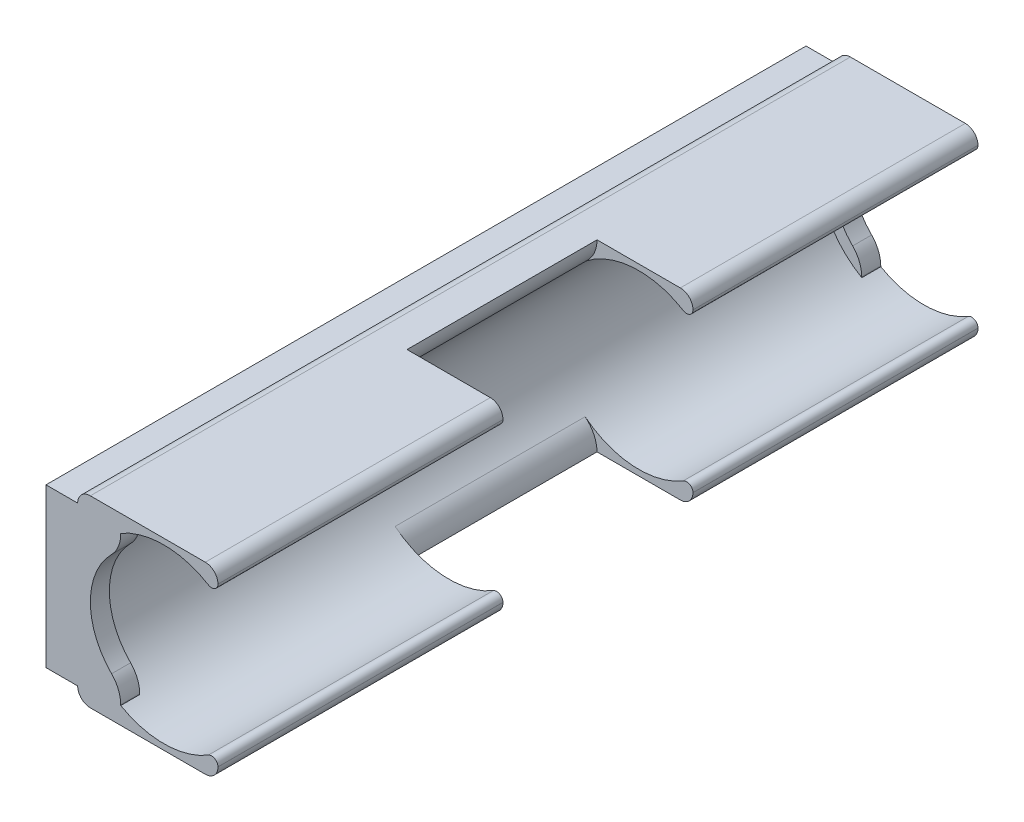
from build123d import *
from build123d.topology import SkipClean

# Parameters (mm, degrees)
SKETCH1_W          = 120
SKETCH1_H          = 25
BASE_DEPTH         = 5
CLIP_DEPTH         = 120
SKETCH3_R          = 1.5
SCREWHOLES_DEPTH   = 10
CLIPWALL_DEPTH     = 3
ROUNDEDCORNERS_R   = 1
SKETCH5_W          = 15.150992531
SKETCH5_H          = 29
FINGERGAP_DEPTH    = 15
FINGERGROOVE_R     = 5
CUT_EXTRUDE1_START = -2
SKETCH3_3_R        = 3
SKETCH3_3_R_2      = 1.5
CUT_EXTRUDE1_DEPTH = 5


with BuildPart() as part:
    # Sketch1 → Base (new body)
    with BuildSketch(Plane(origin=(0, 0, 0), x_dir=(0, 0, -1), z_dir=(1, 0, 0))):
        with Locations((60, 12.5)):
            Rectangle(SKETCH1_W, SKETCH1_H)
    extrude(amount=BASE_DEPTH)

    # Sketch2 → Clip (add)
    with BuildSketch(Plane.XY):
        with BuildLine():
            Line((25.150992531, 27), (7, 27))
            ThreePointArc((7, 27), (5.585786438, 26.414213562), (5, 25))
            Line((5, 25), (5, 12.5))
            ThreePointArc((5, 12.5), (12.740541767, 24.773008971), (27.150992531, 23.075468156))
            Line((27.150992531, 23.075468156), (27.150992531, 25))
            ThreePointArc((27.150992531, 25), (26.565206094, 26.414213562), (25.150992531, 27))
        make_face()
        with BuildLine():
            ThreePointArc((27.150992531, 1.924531844), (12.740541767, 0.226991029), (5, 12.5))
            Line((5, 12.5), (5, 0))
            ThreePointArc((5, 0), (5.585786438, -1.414213562), (7, -2))
            Line((7, -2), (25.150992531, -2))
            ThreePointArc((25.150992531, -2), (26.565206094, -1.414213562), (27.150992531, 0))
            Line((27.150992531, 0), (27.150992531, 1.924531844))
        make_face()
    extrude(amount=-CLIP_DEPTH)

    # Sketch3 → ScrewHoles (cut)
    with SkipClean():  # the faces are left unmerged after this step: merging them gives an invalid solid
        with BuildSketch(Plane.ZY):
            with Locations((-100, 12.5)):
                Circle(SKETCH3_R)
            with Locations((-20, 12.5)):
                Circle(SKETCH3_R)
        extrude(amount=-SCREWHOLES_DEPTH, mode=Mode.SUBTRACT)

    # Sketch4 → ClipWall (add)
    with SkipClean():  # the faces are left unmerged after this step: merging them gives an invalid solid
        with BuildSketch(Plane.XY):
            with BuildLine():
                ThreePointArc((10.354216867, 4.341136076), (7, 12.5), (10.354216867, 20.658863924))
                ThreePointArc((10.354216867, 20.658863924), (11.424450472, 22.274442864), (11.8, 24.175615615))
                Line((11.8, 24.175615615), (11.8, 24.277945491))
                ThreePointArc((11.8, 24.277945491), (5, 12.5), (11.8, 0.722054509))
                Line((11.8, 0.722054509), (11.8, 0.824384385))
                ThreePointArc((11.8, 0.824384385), (11.424450472, 2.725557136), (10.354216867, 4.341136076))
            make_face()
        clipwall = extrude(amount=-CLIPWALL_DEPTH)

    # Mirror1: ClipWall across plane
    with SkipClean():  # the faces are left unmerged after this step: merging them gives an invalid solid
        add(clipwall.mirror(Plane(origin=(0, 0, -60), x_dir=(1, 0, 0), z_dir=(0, 0, -1))))

    # RoundedCorners
    roundedcorners_edges = [part.edges().sort_by_distance(p)[0] for p in [
        (27.150992531, 23.075468156, -60),
        (27.150992531, 1.924531844, -60),
    ]]
    fillet(roundedcorners_edges, radius=ROUNDEDCORNERS_R)

    # Sketch5 → FingerGap (cut, symmetric)
    with BuildSketch(Plane(origin=(0, 0, -60), x_dir=(-1, 0, 0), z_dir=(0, 0, -1))):
        with Locations((-19.575496265, 12.5)):
            Rectangle(SKETCH5_W, SKETCH5_H)
    extrude(amount=FINGERGAP_DEPTH, both=True, mode=Mode.SUBTRACT)

    # FingerGroove
    # the kernel refuses this fillet: 5 mm, written as the material it takes off along each edge
    with BuildSketch(Plane(origin=(12, 0.608826803, -75), x_dir=(0, -1, 0), z_dir=(0, 0, 1))) as fingergroove_piece_1:
        with BuildLine():
            CenterArc((2.648427898, -5), FINGERGROOVE_R, 90, 51.416397028)
            ThreePointArc((-1.26006702, -1.88172043), (-0.590797761, -0.96713387), (0, 0))
            Line((0, 0), (2.648427898, 0))
        make_face()
    extrude(amount=30, mode=Mode.SUBTRACT)
    with BuildSketch(Plane(origin=(12, 24.391173197, -75), x_dir=(0, 1, 0), z_dir=(0, 0, 1))) as fingergroove_piece_2:
        with BuildLine():
            CenterArc((2.648427898, 5), FINGERGROOVE_R, 218.583602972, 51.416397028)
            ThreePointArc((-1.26006702, 1.88172043), (-0.590797761, 0.96713387), (0, 0))
            Line((0, 0), (2.648427898, 0))
        make_face()
    extrude(amount=30, mode=Mode.SUBTRACT)

    # Sketch3<3> → Cut-Extrude1 (cut)
    # profile 1 of 2: a face of its own
    with BuildSketch(Plane.ZY.offset(CUT_EXTRUDE1_START)):
        with Locations(Location((-100, 12.5, 0), (0, 0, 180))):
            Circle(SKETCH3_3_R)
        with Locations((-100, 12.5)):
            Circle(SKETCH3_3_R_2, mode=Mode.SUBTRACT)
    # profile 2 of 2: a face of its own
    with BuildSketch(Plane.ZY.offset(CUT_EXTRUDE1_START)):
        with Locations(Location((-20, 12.5, 0), (0, 0, 180))):
            Circle(SKETCH3_3_R)
        with Locations(Location((-20, 12.5, 0), (0, 0, 180))):
            Circle(SKETCH3_3_R_2, mode=Mode.SUBTRACT)
    extrude(amount=-CUT_EXTRUDE1_DEPTH, mode=Mode.SUBTRACT)


solid = part.part
